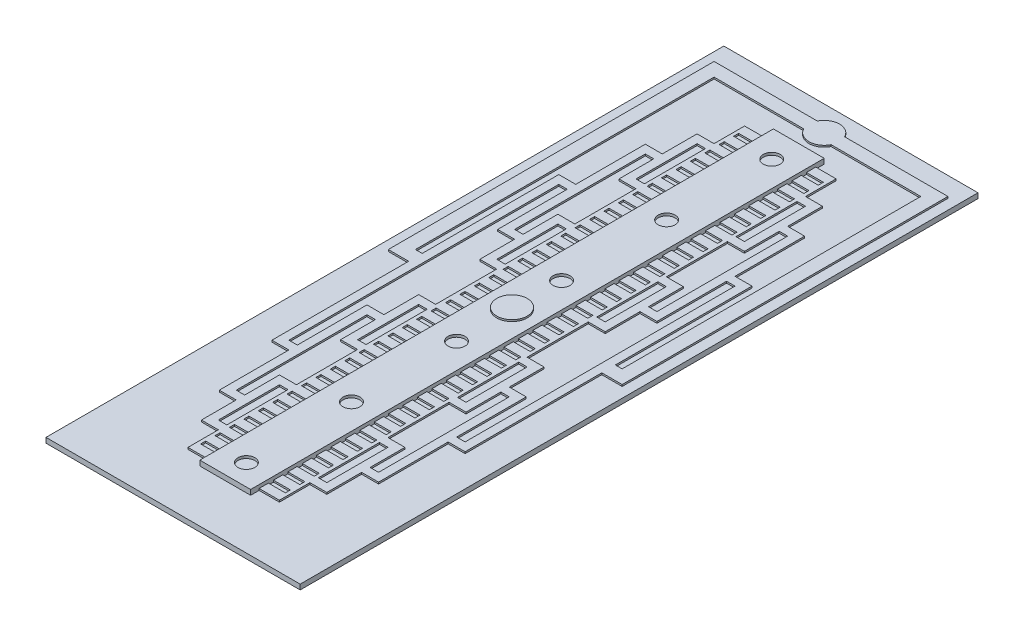
from build123d import *

# Parameters (mm, degrees)
SKETCH2_W           = 15
SKETCH2_H           = 40
BOSS_EXTRUDE1_DEPTH = 0.3
SKETCH3_W           = 3
SKETCH3_H           = 33.85
BOSS_EXTRUDE2_DEPTH = 0.3
SKETCH4_W           = 1.2
SKETCH4_H           = 32.85
BOSS_EXTRUDE3_DEPTH = 0.1
SKETCH5_W           = 1
SKETCH5_H           = 0.3
CUT_EXTRUDE1_DEPTH  = 0.1
BOSS_EXTRUDE4_DEPTH = 0.1
SKETCH7_R           = 0.9
BOSS_EXTRUDE5_DEPTH = 0.1
SKETCH8_R           = 0.5
CUT_EXTRUDE2_DEPTH  = 0.15


with BuildPart() as part:
    # Sketch2 → Boss-Extrude1 (new body)
    with BuildSketch(Plane(origin=(0, 0, 0), x_dir=(1, 0, 0), z_dir=(0, 1, 0))):
        Rectangle(SKETCH2_W, SKETCH2_H)
    extrude(amount=BOSS_EXTRUDE1_DEPTH)

    # Sketch3 → Boss-Extrude2 (add)
    with BuildSketch(Plane(origin=(0, 0.3, 0), x_dir=(1, 0, 0), z_dir=(0, 1, 0))):
        Rectangle(SKETCH3_W, SKETCH3_H)
    extrude(amount=BOSS_EXTRUDE2_DEPTH)

    # Sketch4 → Boss-Extrude3 (add)
    with BuildSketch(Plane(origin=(0, 0.3, 0), x_dir=(1, 0, 0), z_dir=(0, 1, 0))):
        with Locations((2.1, 0)):
            Rectangle(SKETCH4_W, SKETCH4_H)
        with Locations((-2.1, 0)):
            Rectangle(SKETCH4_W, SKETCH4_H)
    extrude(amount=BOSS_EXTRUDE3_DEPTH)

    # Sketch5 → Cut-Extrude1 (cut)
    with BuildSketch(Plane(origin=(0, 0.4, 0), x_dir=(1, 0, 0), z_dir=(0, 1, 0))):
        with Locations((2, 15.725)):
            Rectangle(SKETCH5_W, SKETCH5_H)
        with Locations((-2, 15.725)):
            Rectangle(SKETCH5_W, SKETCH5_H)
        with Locations((-2, 14.875)):
            Rectangle(SKETCH5_W, SKETCH5_H)
        with Locations((-2, 14.025)):
            Rectangle(SKETCH5_W, SKETCH5_H)
        with Locations((-2, 13.175)):
            Rectangle(SKETCH5_W, SKETCH5_H)
        with Locations((-2, 12.325)):
            Rectangle(SKETCH5_W, SKETCH5_H)
        with Locations((-2, 11.475)):
            Rectangle(SKETCH5_W, SKETCH5_H)
        with Locations((-2, 10.625)):
            Rectangle(SKETCH5_W, SKETCH5_H)
        with Locations((-2, 9.775)):
            Rectangle(SKETCH5_W, SKETCH5_H)
        with Locations((-2, 8.925)):
            Rectangle(SKETCH5_W, SKETCH5_H)
        with Locations((-2, 8.075)):
            Rectangle(SKETCH5_W, SKETCH5_H)
        with Locations((-2, 7.225)):
            Rectangle(SKETCH5_W, SKETCH5_H)
        with Locations((-2, 6.375)):
            Rectangle(SKETCH5_W, SKETCH5_H)
        with Locations((-2, 5.525)):
            Rectangle(SKETCH5_W, SKETCH5_H)
        with Locations((-2, 4.675)):
            Rectangle(SKETCH5_W, SKETCH5_H)
        with Locations((-2, 3.825)):
            Rectangle(SKETCH5_W, SKETCH5_H)
        with Locations((-2, 2.975)):
            Rectangle(SKETCH5_W, SKETCH5_H)
        with Locations((-2, 2.125)):
            Rectangle(SKETCH5_W, SKETCH5_H)
        with Locations((-2, 1.275)):
            Rectangle(SKETCH5_W, SKETCH5_H)
        with Locations((-2, 0.425)):
            Rectangle(SKETCH5_W, SKETCH5_H)
        with Locations((-2, -0.425)):
            Rectangle(SKETCH5_W, SKETCH5_H)
        with Locations((-2, -1.275)):
            Rectangle(SKETCH5_W, SKETCH5_H)
        with Locations((-2, -2.125)):
            Rectangle(SKETCH5_W, SKETCH5_H)
        with Locations((-2, -2.975)):
            Rectangle(SKETCH5_W, SKETCH5_H)
        with Locations((-2, -3.825)):
            Rectangle(SKETCH5_W, SKETCH5_H)
        with Locations((-2, -4.675)):
            Rectangle(SKETCH5_W, SKETCH5_H)
        with Locations((-2, -5.525)):
            Rectangle(SKETCH5_W, SKETCH5_H)
        with Locations((-2, -6.375)):
            Rectangle(SKETCH5_W, SKETCH5_H)
        with Locations((-2, -7.225)):
            Rectangle(SKETCH5_W, SKETCH5_H)
        with Locations((-2, -8.075)):
            Rectangle(SKETCH5_W, SKETCH5_H)
        with Locations((-2, -8.925)):
            Rectangle(SKETCH5_W, SKETCH5_H)
        with Locations((-2, -9.775)):
            Rectangle(SKETCH5_W, SKETCH5_H)
        with Locations((-2, -10.625)):
            Rectangle(SKETCH5_W, SKETCH5_H)
        with Locations((-2, -11.475)):
            Rectangle(SKETCH5_W, SKETCH5_H)
        with Locations((-2, -12.325)):
            Rectangle(SKETCH5_W, SKETCH5_H)
        with Locations((-2, -13.175)):
            Rectangle(SKETCH5_W, SKETCH5_H)
        with Locations((-2, -14.025)):
            Rectangle(SKETCH5_W, SKETCH5_H)
        with Locations((-2, -14.875)):
            Rectangle(SKETCH5_W, SKETCH5_H)
        with Locations((-2, -15.725)):
            Rectangle(SKETCH5_W, SKETCH5_H)
        with Locations((2, 14.875)):
            Rectangle(SKETCH5_W, SKETCH5_H)
        with Locations((2, 14.025)):
            Rectangle(SKETCH5_W, SKETCH5_H)
        with Locations((2, 13.175)):
            Rectangle(SKETCH5_W, SKETCH5_H)
        with Locations((2, 12.325)):
            Rectangle(SKETCH5_W, SKETCH5_H)
        with Locations((2, 11.475)):
            Rectangle(SKETCH5_W, SKETCH5_H)
        with Locations((2, 10.625)):
            Rectangle(SKETCH5_W, SKETCH5_H)
        with Locations((2, 9.775)):
            Rectangle(SKETCH5_W, SKETCH5_H)
        with Locations((2, 8.925)):
            Rectangle(SKETCH5_W, SKETCH5_H)
        with Locations((2, 8.075)):
            Rectangle(SKETCH5_W, SKETCH5_H)
        with Locations((2, 7.225)):
            Rectangle(SKETCH5_W, SKETCH5_H)
        with Locations((2, 6.375)):
            Rectangle(SKETCH5_W, SKETCH5_H)
        with Locations((2, 5.525)):
            Rectangle(SKETCH5_W, SKETCH5_H)
        with Locations((2, 4.675)):
            Rectangle(SKETCH5_W, SKETCH5_H)
        with Locations((2, 3.825)):
            Rectangle(SKETCH5_W, SKETCH5_H)
        with Locations((2, 2.975)):
            Rectangle(SKETCH5_W, SKETCH5_H)
        with Locations((2, 2.125)):
            Rectangle(SKETCH5_W, SKETCH5_H)
        with Locations((2, 1.275)):
            Rectangle(SKETCH5_W, SKETCH5_H)
        with Locations((2, 0.425)):
            Rectangle(SKETCH5_W, SKETCH5_H)
        with Locations((2, -0.425)):
            Rectangle(SKETCH5_W, SKETCH5_H)
        with Locations((2, -1.275)):
            Rectangle(SKETCH5_W, SKETCH5_H)
        with Locations((2, -2.125)):
            Rectangle(SKETCH5_W, SKETCH5_H)
        with Locations((2, -2.975)):
            Rectangle(SKETCH5_W, SKETCH5_H)
        with Locations((2, -3.825)):
            Rectangle(SKETCH5_W, SKETCH5_H)
        with Locations((2, -4.675)):
            Rectangle(SKETCH5_W, SKETCH5_H)
        with Locations((2, -5.525)):
            Rectangle(SKETCH5_W, SKETCH5_H)
        with Locations((2, -6.375)):
            Rectangle(SKETCH5_W, SKETCH5_H)
        with Locations((2, -7.225)):
            Rectangle(SKETCH5_W, SKETCH5_H)
        with Locations((2, -8.075)):
            Rectangle(SKETCH5_W, SKETCH5_H)
        with Locations((2, -8.925)):
            Rectangle(SKETCH5_W, SKETCH5_H)
        with Locations((2, -9.775)):
            Rectangle(SKETCH5_W, SKETCH5_H)
        with Locations((2, -10.625)):
            Rectangle(SKETCH5_W, SKETCH5_H)
        with Locations((2, -11.475)):
            Rectangle(SKETCH5_W, SKETCH5_H)
        with Locations((2, -12.325)):
            Rectangle(SKETCH5_W, SKETCH5_H)
        with Locations((2, -13.175)):
            Rectangle(SKETCH5_W, SKETCH5_H)
        with Locations((2, -14.025)):
            Rectangle(SKETCH5_W, SKETCH5_H)
        with Locations((2, -14.875)):
            Rectangle(SKETCH5_W, SKETCH5_H)
        with Locations((2, -15.725)):
            Rectangle(SKETCH5_W, SKETCH5_H)
    extrude(amount=-CUT_EXTRUDE1_DEPTH, mode=Mode.SUBTRACT)

    # Sketch6 → Boss-Extrude4 (add)
    with BuildSketch(Plane(origin=(0, 0.3, 0), x_dir=(1, 0, 0), z_dir=(0, 1, 0))):
        with BuildLine():
            Line((-0.806225775, 18.825), (-6.9, 18.825))
            Line((-6.9, 18.825), (-6.9, -0.4))
            Line((-6.9, -0.4), (-5.7, -0.4))
            Line((-5.7, -0.4), (-5.7, -8.467428181))
            Line((-5.7, -8.467428181), (-4.7, -8.467428181))
            Line((-4.7, -8.467428181), (-4.7, -12.574499544))
            Line((-4.7, -12.574499544), (-3.7, -12.574499544))
            Line((-3.7, -12.574499544), (-3.7, -14.628035226))
            Line((-3.7, -14.628035226), (-2.7, -14.628035226))
            Line((-2.7, -14.628035226), (-2.7, -14.128035226))
            Line((-2.7, -14.128035226), (-3.2, -14.128035226))
            Line((-3.2, -14.128035226), (-3.2, -10.520963862))
            Line((-3.2, -10.520963862), (-2.7, -10.520963862))
            Line((-2.7, -10.520963862), (-2.7, -10.020963862))
            Line((-2.7, -10.020963862), (-3.7, -10.020963862))
            Line((-3.7, -10.020963862), (-3.7, -12.074499544))
            Line((-3.7, -12.074499544), (-4.199998321, -12.074499544))
            Line((-4.199998321, -12.074499544), (-4.199998321, -4.360356817))
            Line((-4.199998321, -4.360356817), (-3.699998321, -4.360356817))
            Line((-3.699998321, -4.360356817), (-3.699998321, -6.413892499))
            Line((-3.699998321, -6.413892499), (-2.7, -6.413892499))
            Line((-2.7, -6.413892499), (-2.7, -5.913892499))
            Line((-2.7, -5.913892499), (-3.2, -5.913892499))
            Line((-3.2, -5.913892499), (-3.2, -2.306821136))
            Line((-3.2, -2.306821136), (-2.7, -2.306821136))
            Line((-2.7, -2.306821136), (-2.7, -1.806821136))
            Line((-2.7, -1.806821136), (-3.699998321, -1.806821136))
            Line((-3.699998321, -1.806821136), (-3.699998321, -3.860356817))
            Line((-3.699998321, -3.860356817), (-4.7, -3.860356817))
            Line((-4.7, -3.860356817), (-4.7, -7.967428181))
            Line((-4.7, -7.967428181), (-5.2, -7.967428181))
            Line((-5.2, -7.967428181), (-5.2, 7.960857273))
            Line((-5.2, 7.960857273), (-4.7, 7.960857273))
            Line((-4.7, 7.960857273), (-4.7, 3.85378591))
            Line((-4.7, 3.85378591), (-3.7, 3.85378591))
            Line((-3.7, 3.85378591), (-3.7, 1.800250228))
            Line((-3.7, 1.800250228), (-2.7, 1.800250228))
            Line((-2.7, 1.800250228), (-2.7, 2.300250228))
            Line((-2.7, 2.300250228), (-3.2, 2.300250228))
            Line((-3.2, 2.300250228), (-3.2, 5.907321591))
            Line((-3.2, 5.907321591), (-2.7, 5.907321591))
            Line((-2.7, 5.907321591), (-2.7, 6.407321591))
            Line((-2.7, 6.407321591), (-3.7, 6.407321591))
            Line((-3.7, 6.407321591), (-3.7, 4.35378591))
            Line((-3.7, 4.35378591), (-4.2, 4.35378591))
            Line((-4.2, 4.35378591), (-4.2, 12.067928637))
            Line((-4.2, 12.067928637), (-3.7, 12.067928637))
            Line((-3.7, 12.067928637), (-3.7, 10.014392955))
            Line((-3.7, 10.014392955), (-2.7, 10.014392955))
            Line((-2.7, 10.014392955), (-2.7, 10.514392955))
            Line((-2.7, 10.514392955), (-3.2, 10.514392955))
            Line((-3.2, 10.514392955), (-3.2, 14.121464318))
            Line((-3.2, 14.121464318), (-2.7, 14.121464318))
            Line((-2.7, 14.121464318), (-2.7, 14.621464318))
            Line((-2.7, 14.621464318), (-3.7, 14.621464318))
            Line((-3.7, 14.621464318), (-3.7, 12.567928637))
            Line((-3.7, 12.567928637), (-4.7, 12.567928637))
            Line((-4.7, 12.567928637), (-4.7, 8.460857273))
            Line((-4.7, 8.460857273), (-5.7, 8.460857273))
            Line((-5.7, 8.460857273), (-5.7, 0.4))
            Line((-5.7, 0.4), (-6.1, 0.4))
            Line((-6.1, 0.4), (-6.1, 18.025))
            Line((-6.1, 18.025), (-0.806225775, 18.025))
            ThreePointArc((-0.806225775, 18.025), (0, 17.525), (0.806225775, 18.025))
            Line((0.806225775, 18.025), (6.1, 18.025))
            Line((6.1, 18.025), (6.1, 0.4))
            Line((6.1, 0.4), (5.7, 0.4))
            Line((5.7, 0.4), (5.7, 8.460857273))
            Line((5.7, 8.460857273), (4.7, 8.460857273))
            Line((4.7, 8.460857273), (4.7, 12.567928637))
            Line((4.7, 12.567928637), (3.7, 12.567928637))
            Line((3.7, 12.567928637), (3.7, 14.621464318))
            Line((3.7, 14.621464318), (2.7, 14.621464318))
            Line((2.7, 14.621464318), (2.7, 14.121464318))
            Line((2.7, 14.121464318), (3.2, 14.121464318))
            Line((3.2, 14.121464318), (3.2, 10.514392955))
            Line((3.2, 10.514392955), (2.7, 10.514392955))
            Line((2.7, 10.514392955), (2.7, 10.014392955))
            Line((2.7, 10.014392955), (3.7, 10.014392955))
            Line((3.7, 10.014392955), (3.7, 12.067928637))
            Line((3.7, 12.067928637), (4.2, 12.067928637))
            Line((4.2, 12.067928637), (4.2, 4.35378591))
            Line((4.2, 4.35378591), (3.7, 4.35378591))
            Line((3.7, 4.35378591), (3.7, 6.407321591))
            Line((3.7, 6.407321591), (2.7, 6.407321591))
            Line((2.7, 6.407321591), (2.7, 5.907321591))
            Line((2.7, 5.907321591), (3.2, 5.907321591))
            Line((3.2, 5.907321591), (3.2, 2.300250228))
            Line((3.2, 2.300250228), (2.7, 2.300250228))
            Line((2.7, 2.300250228), (2.7, 1.800250228))
            Line((2.7, 1.800250228), (3.7, 1.800250228))
            Line((3.7, 1.800250228), (3.7, 3.85378591))
            Line((3.7, 3.85378591), (4.7, 3.85378591))
            Line((4.7, 3.85378591), (4.7, 7.960857273))
            Line((4.7, 7.960857273), (5.2, 7.960857273))
            Line((5.2, 7.960857273), (5.2, -7.967428181))
            Line((5.2, -7.967428181), (4.7, -7.967428181))
            Line((4.7, -7.967428181), (4.7, -3.860356817))
            Line((4.7, -3.860356817), (3.699998321, -3.860356817))
            Line((3.699998321, -3.860356817), (3.699998321, -1.806821136))
            Line((3.699998321, -1.806821136), (2.7, -1.806821136))
            Line((2.7, -1.806821136), (2.7, -2.306821136))
            Line((2.7, -2.306821136), (3.2, -2.306821136))
            Line((3.2, -2.306821136), (3.2, -5.913892499))
            Line((3.2, -5.913892499), (2.7, -5.913892499))
            Line((2.7, -5.913892499), (2.7, -6.413892499))
            Line((2.7, -6.413892499), (3.699998321, -6.413892499))
            Line((3.699998321, -6.413892499), (3.699998321, -4.360356817))
            Line((3.699998321, -4.360356817), (4.199998321, -4.360356817))
            Line((4.199998321, -4.360356817), (4.199998321, -12.074499544))
            Line((4.199998321, -12.074499544), (3.7, -12.074499544))
            Line((3.7, -12.074499544), (3.7, -10.020963862))
            Line((3.7, -10.020963862), (2.7, -10.020963862))
            Line((2.7, -10.020963862), (2.7, -10.520963862))
            Line((2.7, -10.520963862), (3.2, -10.520963862))
            Line((3.2, -10.520963862), (3.2, -14.128035226))
            Line((3.2, -14.128035226), (2.7, -14.128035226))
            Line((2.7, -14.128035226), (2.7, -14.628035226))
            Line((2.7, -14.628035226), (3.7, -14.628035226))
            Line((3.7, -14.628035226), (3.7, -12.574499544))
            Line((3.7, -12.574499544), (4.7, -12.574499544))
            Line((4.7, -12.574499544), (4.7, -8.467428181))
            Line((4.7, -8.467428181), (5.7, -8.467428181))
            Line((5.7, -8.467428181), (5.7, -0.4))
            Line((5.7, -0.4), (6.9, -0.4))
            Line((6.9, -0.4), (6.9, 18.825))
            Line((6.9, 18.825), (0.806225775, 18.825))
            ThreePointArc((0.806225775, 18.825), (0, 19.325), (-0.806225775, 18.825))
        make_face()
    extrude(amount=BOSS_EXTRUDE4_DEPTH)

    # Sketch7 → Boss-Extrude5 (add)
    with BuildSketch(Plane(origin=(0, 0.6, 0), x_dir=(1, 0, 0), z_dir=(0, 1, 0))):
        Circle(SKETCH7_R)
    extrude(amount=BOSS_EXTRUDE5_DEPTH)

    # Sketch8 → Cut-Extrude2 (cut)
    with BuildSketch(Plane(origin=(0, 0.6, 0), x_dir=(1, 0, 0), z_dir=(0, 1, 0))):
        with Locations((0, 15.326485242)):
            Circle(SKETCH8_R)
        with Locations((0, 9.126485242)):
            Circle(SKETCH8_R)
        with Locations((0, 2.926485242)):
            Circle(SKETCH8_R)
        with Locations((0, -3.273514758)):
            Circle(SKETCH8_R)
        with Locations((0, -9.473514758)):
            Circle(SKETCH8_R)
        with Locations((0, -15.673514758)):
            Circle(SKETCH8_R)
    extrude(amount=-CUT_EXTRUDE2_DEPTH, mode=Mode.SUBTRACT)


solid = part.part
